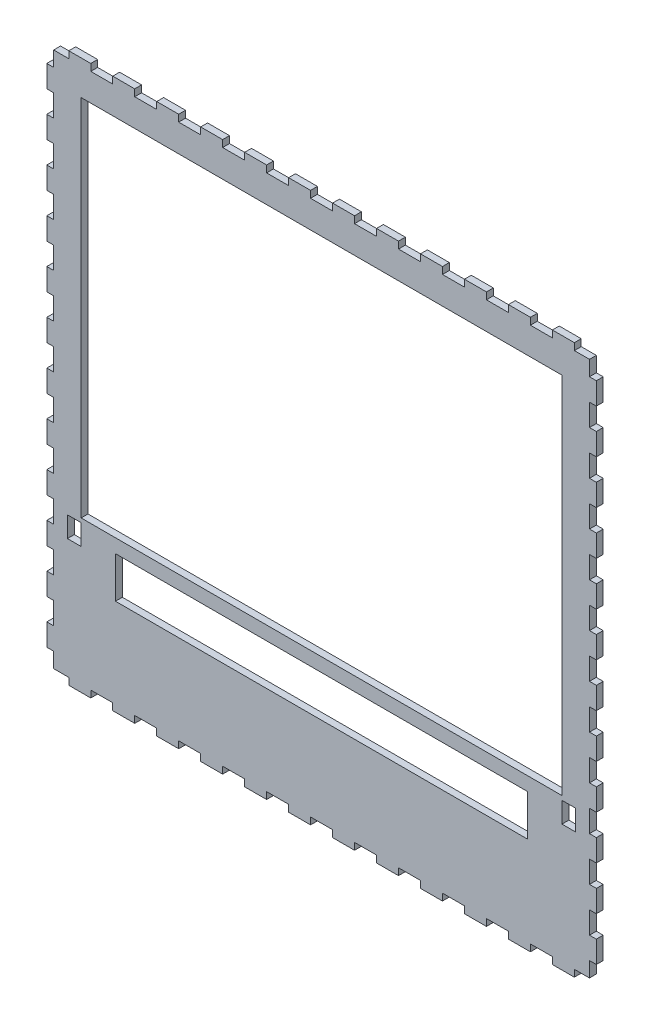
from build123d import *

# Parameters (mm, degrees)
ESQUISSE1_W                = 400
ESQUISSE1_H                = 400
ESQUISSE1_W_2              = 350
ESQUISSE1_H_2              = 265
ESQUISSE1_W_3              = 300
ESQUISSE1_H_3              = 30
BOSS_EXTRU_1_DEPTH         = 5
ESQUISSE2_W                = 16
ESQUISSE2_H                = 5
ENL_V_MAT_EXTRU_1_DEPTH    = 5
R_P_TITION_LIN_AIRE1_COUNT = 13
R_P_TITION_LIN_AIRE1_PITCH = 32
SYM_TRIE1_COPY_1_SKETCH_W  = 16
SYM_TRIE1_COPY_1_SKETCH_H  = 5
SYM_TRIE1_COPY_1_DEPTH     = 5
SYM_TRIE1_COPY_2_SKETCH_W  = 16
SYM_TRIE1_COPY_2_SKETCH_H  = 5
SYM_TRIE1_COPY_2_DEPTH     = 5
SYM_TRIE1_COPY_3_SKETCH_W  = 16
SYM_TRIE1_COPY_3_SKETCH_H  = 5
SYM_TRIE1_COPY_3_DEPTH     = 5
SYM_TRIE1_COPY_4_SKETCH_W  = 16
SYM_TRIE1_COPY_4_SKETCH_H  = 5
SYM_TRIE1_COPY_4_DEPTH     = 5
SYM_TRIE1_COPY_5_SKETCH_W  = 16
SYM_TRIE1_COPY_5_SKETCH_H  = 5
SYM_TRIE1_COPY_5_DEPTH     = 5
SYM_TRIE1_COPY_6_SKETCH_W  = 16
SYM_TRIE1_COPY_6_SKETCH_H  = 5
SYM_TRIE1_COPY_6_DEPTH     = 5
SYM_TRIE1_COPY_7_SKETCH_W  = 16
SYM_TRIE1_COPY_7_SKETCH_H  = 5
SYM_TRIE1_COPY_7_DEPTH     = 5
SYM_TRIE1_COPY_8_SKETCH_W  = 16
SYM_TRIE1_COPY_8_SKETCH_H  = 5
SYM_TRIE1_COPY_8_DEPTH     = 5
SYM_TRIE1_COPY_9_SKETCH_W  = 16
SYM_TRIE1_COPY_9_SKETCH_H  = 5
SYM_TRIE1_COPY_9_DEPTH     = 5
SYM_TRIE1_COPY_10_SKETCH_W = 16
SYM_TRIE1_COPY_10_SKETCH_H = 5
SYM_TRIE1_COPY_10_DEPTH    = 5
SYM_TRIE1_COPY_11_SKETCH_W = 16
SYM_TRIE1_COPY_11_SKETCH_H = 5
SYM_TRIE1_COPY_11_DEPTH    = 5
SYM_TRIE1_COPY_12_SKETCH_W = 16
SYM_TRIE1_COPY_12_SKETCH_H = 5
SYM_TRIE1_COPY_12_DEPTH    = 5
SYM_TRIE1_COPY_13_SKETCH_W = 16
SYM_TRIE1_COPY_13_SKETCH_H = 5
SYM_TRIE1_COPY_13_DEPTH    = 5
ESQUISSE3_W                = 5
ESQUISSE3_H                = 16
ENL_V_MAT_EXTRU_2_DEPTH    = 10
R_P_TITION_LIN_AIRE2_COUNT = 13
R_P_TITION_LIN_AIRE2_PITCH = 32
SYM_TRIE2_COPY_1_SKETCH_W  = 5
SYM_TRIE2_COPY_1_SKETCH_H  = 16
SYM_TRIE2_COPY_1_DEPTH     = 10
SYM_TRIE2_COPY_2_SKETCH_W  = 5
SYM_TRIE2_COPY_2_SKETCH_H  = 16
SYM_TRIE2_COPY_2_DEPTH     = 10
SYM_TRIE2_COPY_3_SKETCH_W  = 5
SYM_TRIE2_COPY_3_SKETCH_H  = 16
SYM_TRIE2_COPY_3_DEPTH     = 10
SYM_TRIE2_COPY_4_SKETCH_W  = 5
SYM_TRIE2_COPY_4_SKETCH_H  = 16
SYM_TRIE2_COPY_4_DEPTH     = 10
SYM_TRIE2_COPY_5_SKETCH_W  = 5
SYM_TRIE2_COPY_5_SKETCH_H  = 16
SYM_TRIE2_COPY_5_DEPTH     = 10
SYM_TRIE2_COPY_6_SKETCH_W  = 5
SYM_TRIE2_COPY_6_SKETCH_H  = 16
SYM_TRIE2_COPY_6_DEPTH     = 10
SYM_TRIE2_COPY_7_SKETCH_W  = 5
SYM_TRIE2_COPY_7_SKETCH_H  = 16
SYM_TRIE2_COPY_7_DEPTH     = 10
SYM_TRIE2_COPY_8_SKETCH_W  = 5
SYM_TRIE2_COPY_8_SKETCH_H  = 16
SYM_TRIE2_COPY_8_DEPTH     = 10
SYM_TRIE2_COPY_9_SKETCH_W  = 5
SYM_TRIE2_COPY_9_SKETCH_H  = 16
SYM_TRIE2_COPY_9_DEPTH     = 10
SYM_TRIE2_COPY_10_SKETCH_W = 5
SYM_TRIE2_COPY_10_SKETCH_H = 16
SYM_TRIE2_COPY_10_DEPTH    = 10
SYM_TRIE2_COPY_11_SKETCH_W = 5
SYM_TRIE2_COPY_11_SKETCH_H = 16
SYM_TRIE2_COPY_11_DEPTH    = 10
SYM_TRIE2_COPY_12_SKETCH_W = 5
SYM_TRIE2_COPY_12_SKETCH_H = 16
SYM_TRIE2_COPY_12_DEPTH    = 10
SYM_TRIE2_COPY_13_SKETCH_W = 5
SYM_TRIE2_COPY_13_SKETCH_H = 16
SYM_TRIE2_COPY_13_DEPTH    = 10
ESQUISSE4_W                = 10
ESQUISSE4_H                = 15
ENL_V_MAT_EXTRU_3_DEPTH    = 5


with BuildPart() as part:
    # Esquisse1 → Boss.-Extru.1 (new body)
    with BuildSketch(Plane.XY):
        with Locations((200, -200)):
            Rectangle(ESQUISSE1_W, ESQUISSE1_H)
        with Locations((200, -157.5)):
            Rectangle(ESQUISSE1_W_2, ESQUISSE1_H_2, mode=Mode.SUBTRACT)
        with Locations((200, -315)):
            Rectangle(ESQUISSE1_W_3, ESQUISSE1_H_3, mode=Mode.SUBTRACT)
    extrude(amount=BOSS_EXTRU_1_DEPTH)

    # Esquisse2 → Enlèv. mat.-Extru.1 (cut)
    with BuildSketch(Plane.XY.offset(5)):
        with Locations((8, -397.5)):
            Rectangle(ESQUISSE2_W, ESQUISSE2_H)
    enl_v_mat_extru_1 = extrude(amount=-ENL_V_MAT_EXTRU_1_DEPTH, mode=Mode.SUBTRACT)

    # Répétition linéaire1: Enlèv. mat.-Extru.1 ×13
    with Locations(*[(i * R_P_TITION_LIN_AIRE1_PITCH, 0, 0) for i in range(1, R_P_TITION_LIN_AIRE1_COUNT)]):
        add(enl_v_mat_extru_1, mode=Mode.SUBTRACT)

    # Symétrie1 copy 1 sketch → Symétrie1 copy 1 (cut)
    with BuildSketch(Plane(origin=(32, -400, 5), x_dir=(1, 0, 0), z_dir=(0, 0, 1))):
        with Locations((8, 397.5)):
            Rectangle(SYM_TRIE1_COPY_1_SKETCH_W, SYM_TRIE1_COPY_1_SKETCH_H)
    extrude(amount=-SYM_TRIE1_COPY_1_DEPTH, mode=Mode.SUBTRACT)

    # Symétrie1 copy 2 sketch → Symétrie1 copy 2 (cut)
    with BuildSketch(Plane(origin=(64, -400, 5), x_dir=(1, 0, 0), z_dir=(0, 0, 1))):
        with Locations((8, 397.5)):
            Rectangle(SYM_TRIE1_COPY_2_SKETCH_W, SYM_TRIE1_COPY_2_SKETCH_H)
    extrude(amount=-SYM_TRIE1_COPY_2_DEPTH, mode=Mode.SUBTRACT)

    # Symétrie1 copy 3 sketch → Symétrie1 copy 3 (cut)
    with BuildSketch(Plane(origin=(96, -400, 5), x_dir=(1, 0, 0), z_dir=(0, 0, 1))):
        with Locations((8, 397.5)):
            Rectangle(SYM_TRIE1_COPY_3_SKETCH_W, SYM_TRIE1_COPY_3_SKETCH_H)
    extrude(amount=-SYM_TRIE1_COPY_3_DEPTH, mode=Mode.SUBTRACT)

    # Symétrie1 copy 4 sketch → Symétrie1 copy 4 (cut)
    with BuildSketch(Plane(origin=(128, -400, 5), x_dir=(1, 0, 0), z_dir=(0, 0, 1))):
        with Locations((8, 397.5)):
            Rectangle(SYM_TRIE1_COPY_4_SKETCH_W, SYM_TRIE1_COPY_4_SKETCH_H)
    extrude(amount=-SYM_TRIE1_COPY_4_DEPTH, mode=Mode.SUBTRACT)

    # Symétrie1 copy 5 sketch → Symétrie1 copy 5 (cut)
    with BuildSketch(Plane(origin=(160, -400, 5), x_dir=(1, 0, 0), z_dir=(0, 0, 1))):
        with Locations((8, 397.5)):
            Rectangle(SYM_TRIE1_COPY_5_SKETCH_W, SYM_TRIE1_COPY_5_SKETCH_H)
    extrude(amount=-SYM_TRIE1_COPY_5_DEPTH, mode=Mode.SUBTRACT)

    # Symétrie1 copy 6 sketch → Symétrie1 copy 6 (cut)
    with BuildSketch(Plane(origin=(192, -400, 5), x_dir=(1, 0, 0), z_dir=(0, 0, 1))):
        with Locations((8, 397.5)):
            Rectangle(SYM_TRIE1_COPY_6_SKETCH_W, SYM_TRIE1_COPY_6_SKETCH_H)
    extrude(amount=-SYM_TRIE1_COPY_6_DEPTH, mode=Mode.SUBTRACT)

    # Symétrie1 copy 7 sketch → Symétrie1 copy 7 (cut)
    with BuildSketch(Plane(origin=(224, -400, 5), x_dir=(1, 0, 0), z_dir=(0, 0, 1))):
        with Locations((8, 397.5)):
            Rectangle(SYM_TRIE1_COPY_7_SKETCH_W, SYM_TRIE1_COPY_7_SKETCH_H)
    extrude(amount=-SYM_TRIE1_COPY_7_DEPTH, mode=Mode.SUBTRACT)

    # Symétrie1 copy 8 sketch → Symétrie1 copy 8 (cut)
    with BuildSketch(Plane(origin=(256, -400, 5), x_dir=(1, 0, 0), z_dir=(0, 0, 1))):
        with Locations((8, 397.5)):
            Rectangle(SYM_TRIE1_COPY_8_SKETCH_W, SYM_TRIE1_COPY_8_SKETCH_H)
    extrude(amount=-SYM_TRIE1_COPY_8_DEPTH, mode=Mode.SUBTRACT)

    # Symétrie1 copy 9 sketch → Symétrie1 copy 9 (cut)
    with BuildSketch(Plane(origin=(288, -400, 5), x_dir=(1, 0, 0), z_dir=(0, 0, 1))):
        with Locations((8, 397.5)):
            Rectangle(SYM_TRIE1_COPY_9_SKETCH_W, SYM_TRIE1_COPY_9_SKETCH_H)
    extrude(amount=-SYM_TRIE1_COPY_9_DEPTH, mode=Mode.SUBTRACT)

    # Symétrie1 copy 10 sketch → Symétrie1 copy 10 (cut)
    with BuildSketch(Plane(origin=(320, -400, 5), x_dir=(1, 0, 0), z_dir=(0, 0, 1))):
        with Locations((8, 397.5)):
            Rectangle(SYM_TRIE1_COPY_10_SKETCH_W, SYM_TRIE1_COPY_10_SKETCH_H)
    extrude(amount=-SYM_TRIE1_COPY_10_DEPTH, mode=Mode.SUBTRACT)

    # Symétrie1 copy 11 sketch → Symétrie1 copy 11 (cut)
    with BuildSketch(Plane(origin=(352, -400, 5), x_dir=(1, 0, 0), z_dir=(0, 0, 1))):
        with Locations((8, 397.5)):
            Rectangle(SYM_TRIE1_COPY_11_SKETCH_W, SYM_TRIE1_COPY_11_SKETCH_H)
    extrude(amount=-SYM_TRIE1_COPY_11_DEPTH, mode=Mode.SUBTRACT)

    # Symétrie1 copy 12 sketch → Symétrie1 copy 12 (cut)
    with BuildSketch(Plane(origin=(384, -400, 5), x_dir=(1, 0, 0), z_dir=(0, 0, 1))):
        with Locations((8, 397.5)):
            Rectangle(SYM_TRIE1_COPY_12_SKETCH_W, SYM_TRIE1_COPY_12_SKETCH_H)
    extrude(amount=-SYM_TRIE1_COPY_12_DEPTH, mode=Mode.SUBTRACT)

    # Symétrie1 copy 13 sketch → Symétrie1 copy 13 (cut)
    with BuildSketch(Plane(origin=(0, -400, 5), x_dir=(1, 0, 0), z_dir=(0, 0, 1))):
        with Locations((8, 397.5)):
            Rectangle(SYM_TRIE1_COPY_13_SKETCH_W, SYM_TRIE1_COPY_13_SKETCH_H)
    extrude(amount=-SYM_TRIE1_COPY_13_DEPTH, mode=Mode.SUBTRACT)

    # Esquisse3 → Enlèv. mat.-Extru.2 (cut)
    with BuildSketch(Plane.XY.offset(5)):
        with Locations((2.5, -392)):
            Rectangle(ESQUISSE3_W, ESQUISSE3_H)
    enl_v_mat_extru_2 = extrude(amount=-ENL_V_MAT_EXTRU_2_DEPTH, mode=Mode.SUBTRACT)

    # Répétition linéaire2: Enlèv. mat.-Extru.2 ×13
    with Locations(*[(0, i * R_P_TITION_LIN_AIRE2_PITCH, 0) for i in range(1, R_P_TITION_LIN_AIRE2_COUNT)]):
        add(enl_v_mat_extru_2, mode=Mode.SUBTRACT)

    # Symétrie2 copy 1 sketch → Symétrie2 copy 1 (cut)
    with BuildSketch(Plane(origin=(400, 32, 5), x_dir=(-1, 0, 0), z_dir=(0, 0, 1))):
        with Locations((2.5, 392)):
            Rectangle(SYM_TRIE2_COPY_1_SKETCH_W, SYM_TRIE2_COPY_1_SKETCH_H)
    extrude(amount=-SYM_TRIE2_COPY_1_DEPTH, mode=Mode.SUBTRACT)

    # Symétrie2 copy 2 sketch → Symétrie2 copy 2 (cut)
    with BuildSketch(Plane(origin=(400, 64, 5), x_dir=(-1, 0, 0), z_dir=(0, 0, 1))):
        with Locations((2.5, 392)):
            Rectangle(SYM_TRIE2_COPY_2_SKETCH_W, SYM_TRIE2_COPY_2_SKETCH_H)
    extrude(amount=-SYM_TRIE2_COPY_2_DEPTH, mode=Mode.SUBTRACT)

    # Symétrie2 copy 3 sketch → Symétrie2 copy 3 (cut)
    with BuildSketch(Plane(origin=(400, 96, 5), x_dir=(-1, 0, 0), z_dir=(0, 0, 1))):
        with Locations((2.5, 392)):
            Rectangle(SYM_TRIE2_COPY_3_SKETCH_W, SYM_TRIE2_COPY_3_SKETCH_H)
    extrude(amount=-SYM_TRIE2_COPY_3_DEPTH, mode=Mode.SUBTRACT)

    # Symétrie2 copy 4 sketch → Symétrie2 copy 4 (cut)
    with BuildSketch(Plane(origin=(400, 128, 5), x_dir=(-1, 0, 0), z_dir=(0, 0, 1))):
        with Locations((2.5, 392)):
            Rectangle(SYM_TRIE2_COPY_4_SKETCH_W, SYM_TRIE2_COPY_4_SKETCH_H)
    extrude(amount=-SYM_TRIE2_COPY_4_DEPTH, mode=Mode.SUBTRACT)

    # Symétrie2 copy 5 sketch → Symétrie2 copy 5 (cut)
    with BuildSketch(Plane(origin=(400, 160, 5), x_dir=(-1, 0, 0), z_dir=(0, 0, 1))):
        with Locations((2.5, 392)):
            Rectangle(SYM_TRIE2_COPY_5_SKETCH_W, SYM_TRIE2_COPY_5_SKETCH_H)
    extrude(amount=-SYM_TRIE2_COPY_5_DEPTH, mode=Mode.SUBTRACT)

    # Symétrie2 copy 6 sketch → Symétrie2 copy 6 (cut)
    with BuildSketch(Plane(origin=(400, 192, 5), x_dir=(-1, 0, 0), z_dir=(0, 0, 1))):
        with Locations((2.5, 392)):
            Rectangle(SYM_TRIE2_COPY_6_SKETCH_W, SYM_TRIE2_COPY_6_SKETCH_H)
    extrude(amount=-SYM_TRIE2_COPY_6_DEPTH, mode=Mode.SUBTRACT)

    # Symétrie2 copy 7 sketch → Symétrie2 copy 7 (cut)
    with BuildSketch(Plane(origin=(400, 224, 5), x_dir=(-1, 0, 0), z_dir=(0, 0, 1))):
        with Locations((2.5, 392)):
            Rectangle(SYM_TRIE2_COPY_7_SKETCH_W, SYM_TRIE2_COPY_7_SKETCH_H)
    extrude(amount=-SYM_TRIE2_COPY_7_DEPTH, mode=Mode.SUBTRACT)

    # Symétrie2 copy 8 sketch → Symétrie2 copy 8 (cut)
    with BuildSketch(Plane(origin=(400, 256, 5), x_dir=(-1, 0, 0), z_dir=(0, 0, 1))):
        with Locations((2.5, 392)):
            Rectangle(SYM_TRIE2_COPY_8_SKETCH_W, SYM_TRIE2_COPY_8_SKETCH_H)
    extrude(amount=-SYM_TRIE2_COPY_8_DEPTH, mode=Mode.SUBTRACT)

    # Symétrie2 copy 9 sketch → Symétrie2 copy 9 (cut)
    with BuildSketch(Plane(origin=(400, 288, 5), x_dir=(-1, 0, 0), z_dir=(0, 0, 1))):
        with Locations((2.5, 392)):
            Rectangle(SYM_TRIE2_COPY_9_SKETCH_W, SYM_TRIE2_COPY_9_SKETCH_H)
    extrude(amount=-SYM_TRIE2_COPY_9_DEPTH, mode=Mode.SUBTRACT)

    # Symétrie2 copy 10 sketch → Symétrie2 copy 10 (cut)
    with BuildSketch(Plane(origin=(400, 320, 5), x_dir=(-1, 0, 0), z_dir=(0, 0, 1))):
        with Locations((2.5, 392)):
            Rectangle(SYM_TRIE2_COPY_10_SKETCH_W, SYM_TRIE2_COPY_10_SKETCH_H)
    extrude(amount=-SYM_TRIE2_COPY_10_DEPTH, mode=Mode.SUBTRACT)

    # Symétrie2 copy 11 sketch → Symétrie2 copy 11 (cut)
    with BuildSketch(Plane(origin=(400, 352, 5), x_dir=(-1, 0, 0), z_dir=(0, 0, 1))):
        with Locations((2.5, 392)):
            Rectangle(SYM_TRIE2_COPY_11_SKETCH_W, SYM_TRIE2_COPY_11_SKETCH_H)
    extrude(amount=-SYM_TRIE2_COPY_11_DEPTH, mode=Mode.SUBTRACT)

    # Symétrie2 copy 12 sketch → Symétrie2 copy 12 (cut)
    with BuildSketch(Plane(origin=(400, 384, 5), x_dir=(-1, 0, 0), z_dir=(0, 0, 1))):
        with Locations((2.5, 392)):
            Rectangle(SYM_TRIE2_COPY_12_SKETCH_W, SYM_TRIE2_COPY_12_SKETCH_H)
    extrude(amount=-SYM_TRIE2_COPY_12_DEPTH, mode=Mode.SUBTRACT)

    # Symétrie2 copy 13 sketch → Symétrie2 copy 13 (cut)
    with BuildSketch(Plane(origin=(400, 0, 5), x_dir=(-1, 0, 0), z_dir=(0, 0, 1))):
        with Locations((2.5, 392)):
            Rectangle(SYM_TRIE2_COPY_13_SKETCH_W, SYM_TRIE2_COPY_13_SKETCH_H)
    extrude(amount=-SYM_TRIE2_COPY_13_DEPTH, mode=Mode.SUBTRACT)

    # Esquisse4 → Enlèv. mat.-Extru.3 (cut)
    with BuildSketch(Plane.XY.offset(5)):
        with Locations((380, -300.5)):
            Rectangle(ESQUISSE4_W, ESQUISSE4_H)
    enl_v_mat_extru_3 = extrude(amount=-ENL_V_MAT_EXTRU_3_DEPTH, mode=Mode.SUBTRACT)

    # Symétrie3: Enlèv. mat.-Extru.3 across plane
    add(enl_v_mat_extru_3.mirror(Plane.ZY.offset(-200)), mode=Mode.SUBTRACT)


solid = part.part
